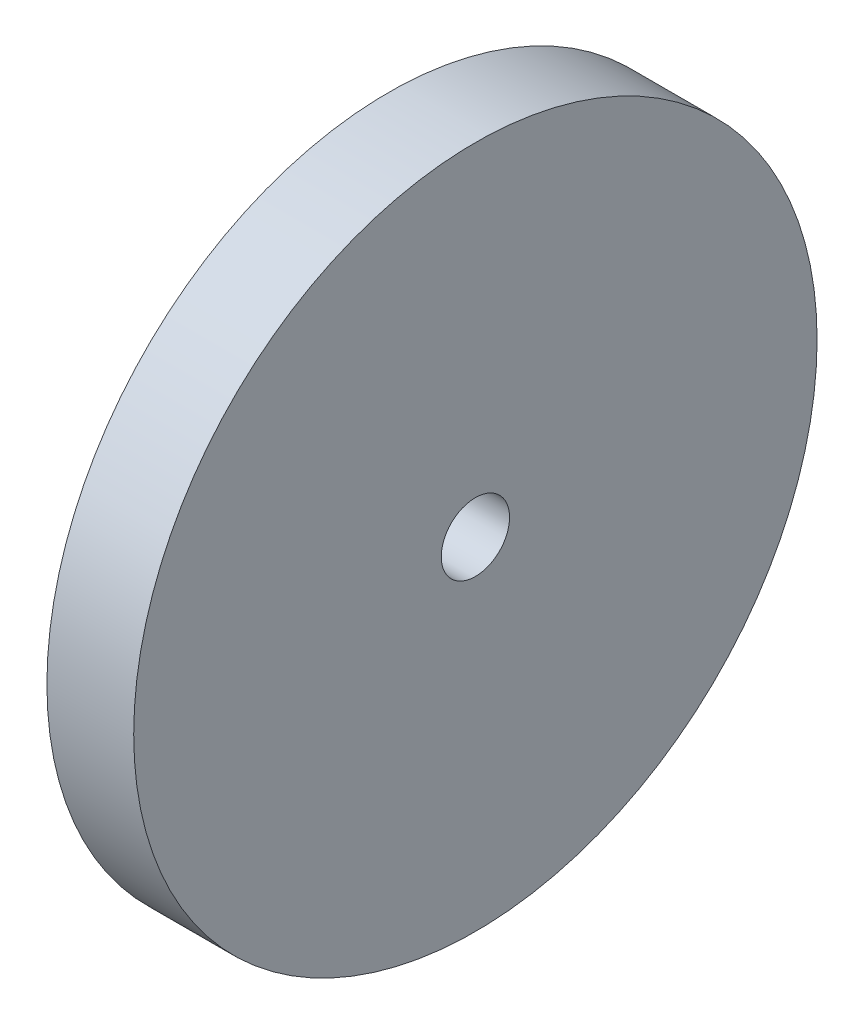
from build123d import *

# Parameters (mm, degrees)
SKETCH1_R           = 50
SKETCH1_R_2         = 5
BOSS_EXTRUDE1_DEPTH = 12.7


with BuildPart() as part:
    # Sketch1 → Boss-Extrude1 (new body)
    with BuildSketch(Plane(origin=(0, 0, 0), x_dir=(0, 0, -1), z_dir=(1, 0, 0))):
        Circle(SKETCH1_R)
        Circle(SKETCH1_R_2, mode=Mode.SUBTRACT)
    extrude(amount=BOSS_EXTRUDE1_DEPTH)


solid = part.part
